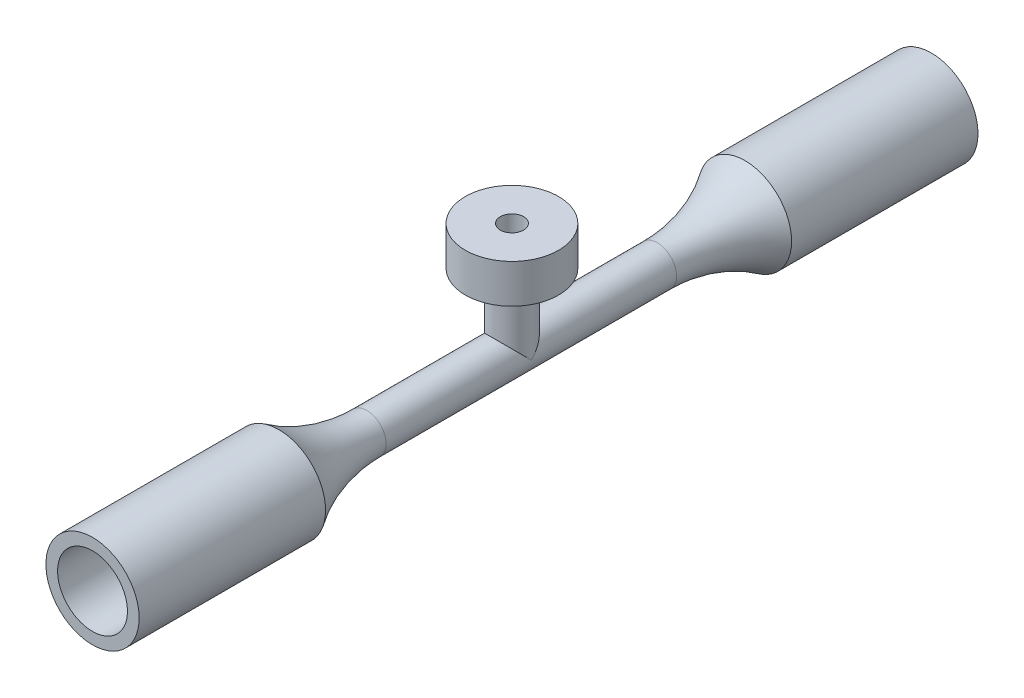
from build123d import *

# Parameters (mm, degrees)
SKETCH1_R           = 3
BOSS_EXTRUDE1_DEPTH = 12
SKETCH2_R           = 1.25
BOSS_EXTRUDE2_DEPTH = 15
BOSS_EXTRUDE3_DEPTH = 4.5
BOSS_EXTRUDE4_DEPTH = 2.5
SKETCH5_R           = 2.25
CUT_EXTRUDE1_DEPTH  = 10.5
SKETCH6_R           = 0.75
CUT_EXTRUDE2_DEPTH  = 21.5
CUT_EXTRUDE3_DEPTH  = 7
FILLET1_R           = 10


with BuildPart() as part:
    # Sketch1 → Boss-Extrude1 (new body)
    with BuildSketch(Plane.XY):
        Circle(SKETCH1_R)
    extrude(amount=BOSS_EXTRUDE1_DEPTH)

    # Sketch2 → Boss-Extrude2 (add)
    with BuildSketch(Plane.XY.offset(12)):
        Circle(SKETCH2_R)
    extrude(amount=BOSS_EXTRUDE2_DEPTH)

    # Sketch3 → Boss-Extrude3 (add)
    with BuildSketch(Plane(origin=(0, 0, 0), x_dir=(1, 0, 0), z_dir=(0, 1, 0))):
        with BuildLine():
            Line((-1.25, -27), (1.25, -27))
            ThreePointArc((1.25, -27), (0, -25.75), (-1.25, -27))
        make_face()
    extrude(amount=BOSS_EXTRUDE3_DEPTH)

    # Sketch4 → Boss-Extrude4 (add)
    with BuildSketch(Plane(origin=(0, 4.5, 0), x_dir=(1, 0, 0), z_dir=(0, 1, 0))):
        with BuildLine():
            Line((-3, -27), (3, -27))
            ThreePointArc((3, -27), (0, -24), (-3, -27))
        make_face()
    extrude(amount=BOSS_EXTRUDE4_DEPTH)

    # Sketch5 → Cut-Extrude1 (cut)
    with BuildSketch(Plane(origin=(0, 0, 0), x_dir=(-1, 0, 0), z_dir=(0, 0, -1))):
        Circle(SKETCH5_R)
    extrude(amount=-CUT_EXTRUDE1_DEPTH, mode=Mode.SUBTRACT)

    # Sketch6 → Cut-Extrude2 (cut)
    with BuildSketch(Plane.XY.offset(27)):
        Circle(SKETCH6_R)
    extrude(amount=-CUT_EXTRUDE2_DEPTH, mode=Mode.SUBTRACT)

    # Sketch7 → Cut-Extrude3 (cut)
    with BuildSketch(Plane(origin=(0, 7, 0), x_dir=(1, 0, 0), z_dir=(0, 1, 0))):
        with BuildLine():
            Line((-0.75, -27), (-0.75, -27.055459171))
            Line((-0.75, -27.055459171), (0.75, -27.055459171))
            Line((0.75, -27.055459171), (0.75, -27))
            ThreePointArc((0.75, -27), (0, -26.25), (-0.75, -27))
        make_face()
    extrude(amount=-CUT_EXTRUDE3_DEPTH, mode=Mode.SUBTRACT)

    # Fillet1
    # the kernel refuses this fillet: 10 mm, written as the material it adds along each edge
    with BuildSketch(Plane(origin=(0, 0, 12), x_dir=(1, 0, 0), z_dir=(0, -1, 0))) as fillet1_piece_1:
        with BuildLine():
            CenterArc((11.25, 5.651327278), FILLET1_R, 180, 34.41150867)
            Line((3, 0), (2.835, -0.113026546))
            ThreePointArc((2.835, -0.113026546), (2.125, -0.2), (1.25, -0.2))
            Line((1.25, -0.2), (1.05, 0))
            Line((1.05, 0), (1.05, 5.651327278))
            Line((1.05, 5.651327278), (1.25, 5.651327278))
        make_face()
    revolve(axis=Axis((0, 0, 12), (0, 0, 1)))

    # Mirror5: part across plane


with BuildPart() as part_1:
    add(part.part)
    add(part.part.mirror(Plane.XY.offset(27)))


solid = part_1.part
